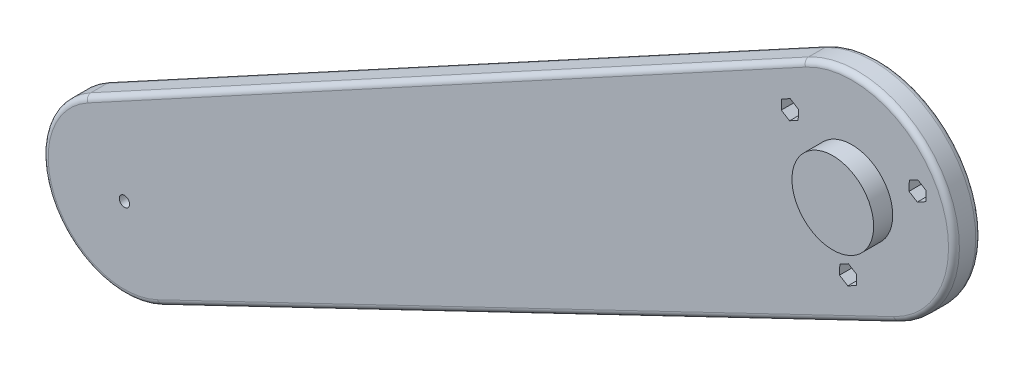
from build123d import *

# Parameters (mm, degrees)
BOSS_EXTRUDE1_DEPTH = 10
FILLET1_R           = 2
CUT_EXTRUDE8_DEPTH  = 5
CUT_EXTRUDE9_START  = -70
SKETCH10_R          = 1.75
CUT_EXTRUDE9_DEPTH  = 71
CIRPATTERN1_COUNT   = 3
SKETCH12_R          = 15
BOSS_EXTRUDE2_DEPTH = 7
CUT_EXTRUDE11_DEPTH = 5
SKETCH15_R          = 1.9
CUT_EXTRUDE12_DEPTH = 5


with BuildPart() as part:
    # Sketch1 → Boss-Extrude1 (new body)
    with BuildSketch(Plane.XY):
        with BuildLine():
            Line((-281.432373232, -110.20807274), (-17.900575614, 32.951773741))
            ThreePointArc((-17.900575614, 32.951773741), (33.388989093, 17.071186467), (16.23112616, -33.805333064))
            Line((16.23112616, -33.805333064), (-254.127011813, -163.613758184))
            ThreePointArc((-254.127011813, -163.613758184), (-293.823104015, -150.226440906), (-281.432373232, -110.20807274))
        make_face()
    extrude(amount=BOSS_EXTRUDE1_DEPTH)

    # Fillet1
    fillet1_edges = [part.edges().sort_by_distance(p)[0] for p in [
        (33.388989093, 17.071186467, 10),
        (-118.947942827, -98.709545624, 10),
        (-293.823104015, -150.226440906, 10),
        (-149.666474423, -38.628149499, 10),
        (-118.947942827, -98.709545624, 0),
        (33.388989093, 17.071186467, 0),
        (-149.666474423, -38.628149499, 0),
        (-293.823104015, -150.226440906, 0),
    ]]
    fillet(fillet1_edges, radius=FILLET1_R)

    # Sketch3 → Cut-Extrude8 (cut)
    with BuildSketch(Plane.XY.offset(10)):
        Polygon((-4.424109202, -25.18892785), (-4.53581637, -28.767184619), (-1.492808691, -30.65305425), (1.661906157, -28.96066711), (1.773613325, -25.382410341), (-1.269394354, -23.496540711), align=None)
        Polygon((27.292728029, 14.033716876), (24.249720349, 15.919586506), (21.095005502, 14.227199366), (20.983298334, 10.648942597), (24.026306013, 8.763072967), (27.181020861, 10.455460106), align=None)
        Polygon((-19.602196811, 16.425854883), (-22.645204491, 18.311724513), (-25.799919338, 16.619337374), (-25.911626506, 13.041080604), (-22.868618827, 11.155210974), (-19.713903979, 12.847598114), align=None)
    extrude(amount=-CUT_EXTRUDE8_DEPTH, mode=Mode.SUBTRACT)

    # Sketch10 → Cut-Extrude9 (cut)
    with BuildSketch(Plane.XY.offset(5).offset(CUT_EXTRUDE9_START)):
        with Locations((24.040072147, 12.291254256)):
            Circle(SKETCH10_R)
    cut_extrude9 = extrude(amount=CUT_EXTRUDE9_DEPTH, mode=Mode.SUBTRACT)

    # CirPattern1: Cut-Extrude9 ×3 about axis
    cirpattern1_axis = Axis((0, 0, 10), (0, 0, -1))
    for i in range(1, CIRPATTERN1_COUNT):
        add(cut_extrude9.rotate(cirpattern1_axis, i * 360 / CIRPATTERN1_COUNT), mode=Mode.SUBTRACT)

    # Sketch12 → Boss-Extrude2 (add)
    with BuildSketch(Plane.XY.offset(10)):
        Circle(SKETCH12_R)
    extrude(amount=BOSS_EXTRUDE2_DEPTH)

    # Sketch14 → Cut-Extrude11 (cut)
    with BuildSketch(Plane(origin=(0, 0, 0), x_dir=(-1, 0, 0), z_dir=(0, 0, -1))):
        Polygon((268.901912741, -139.669862678), (270.691912741, -136.569491732), (268.901912741, -133.469120787), (265.321912741, -133.469120787), (264.347836858, -135.156269707), (263.531912741, -136.569491732), (265.321912741, -139.669862678), align=None)
    extrude(amount=-CUT_EXTRUDE11_DEPTH, mode=Mode.SUBTRACT)

    # Sketch15 → Cut-Extrude12 (cut)
    with BuildSketch(Plane(origin=(0, 0, 5), x_dir=(-1, 0, 0), z_dir=(0, 0, -1))):
        with Locations((267.111912741, -136.569491732)):
            Circle(SKETCH15_R)
    extrude(amount=-CUT_EXTRUDE12_DEPTH, mode=Mode.SUBTRACT)


solid = part.part
